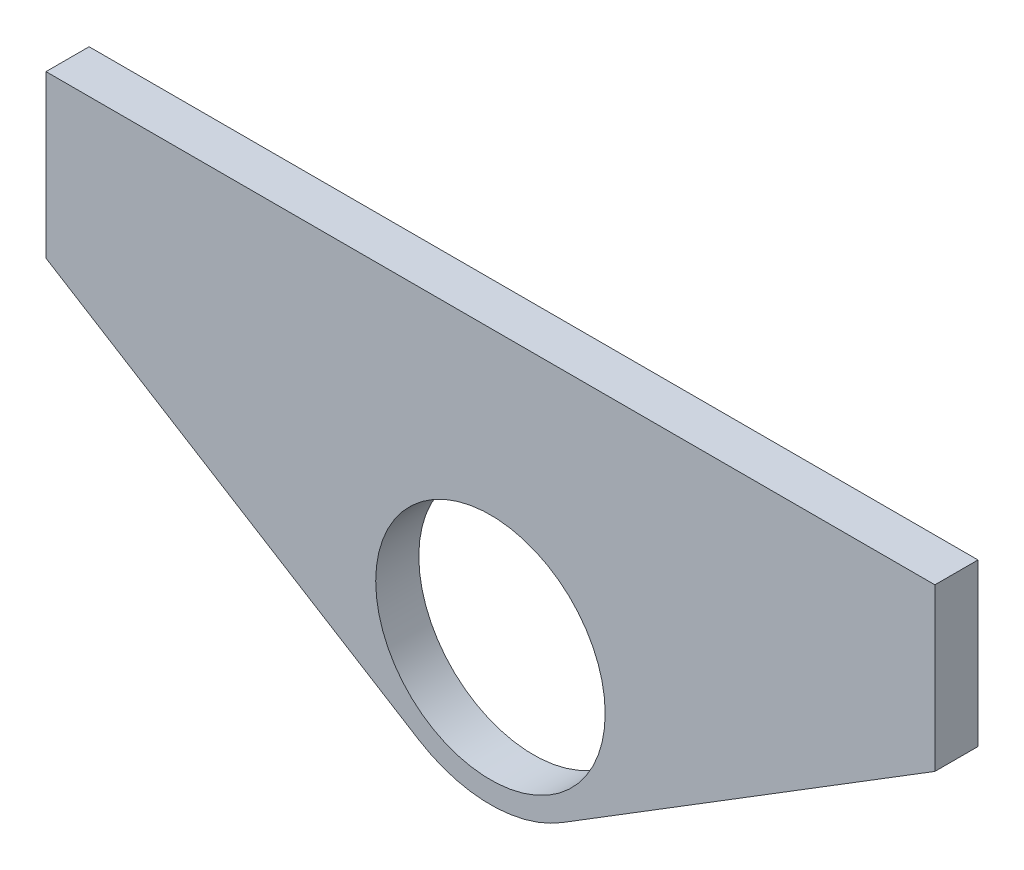
from build123d import *

# Parameters (mm, degrees)
SKETCH_1_R             = 10.65
SM_BASE_FLANGE_1_DEPTH = 4


# Sheet-metal steps are written as plain solids
with BuildPart() as part:
    # Sketch 1 → Базовая кромка1 (new body)
    with BuildSketch(Plane.XY):
        with BuildLine():
            Line((0, 0), (-34.594362709, -21.407039383))
            ThreePointArc((-34.594362709, -21.407039383), (-41.250833524, -23.3), (-47.907304338, -21.407039383))
            Line((-47.907304338, -21.407039383), (-82.501667048, 0))
            Line((-82.501667048, 0), (-82.501667048, 15))
            Line((-82.501667048, 15), (0, 15))
            Line((0, 15), (0, 0))
        make_face()
        with Locations((-41.250833524, -10.65)):
            Circle(SKETCH_1_R, mode=Mode.SUBTRACT)
    extrude(amount=-SM_BASE_FLANGE_1_DEPTH)


solid = part.part
